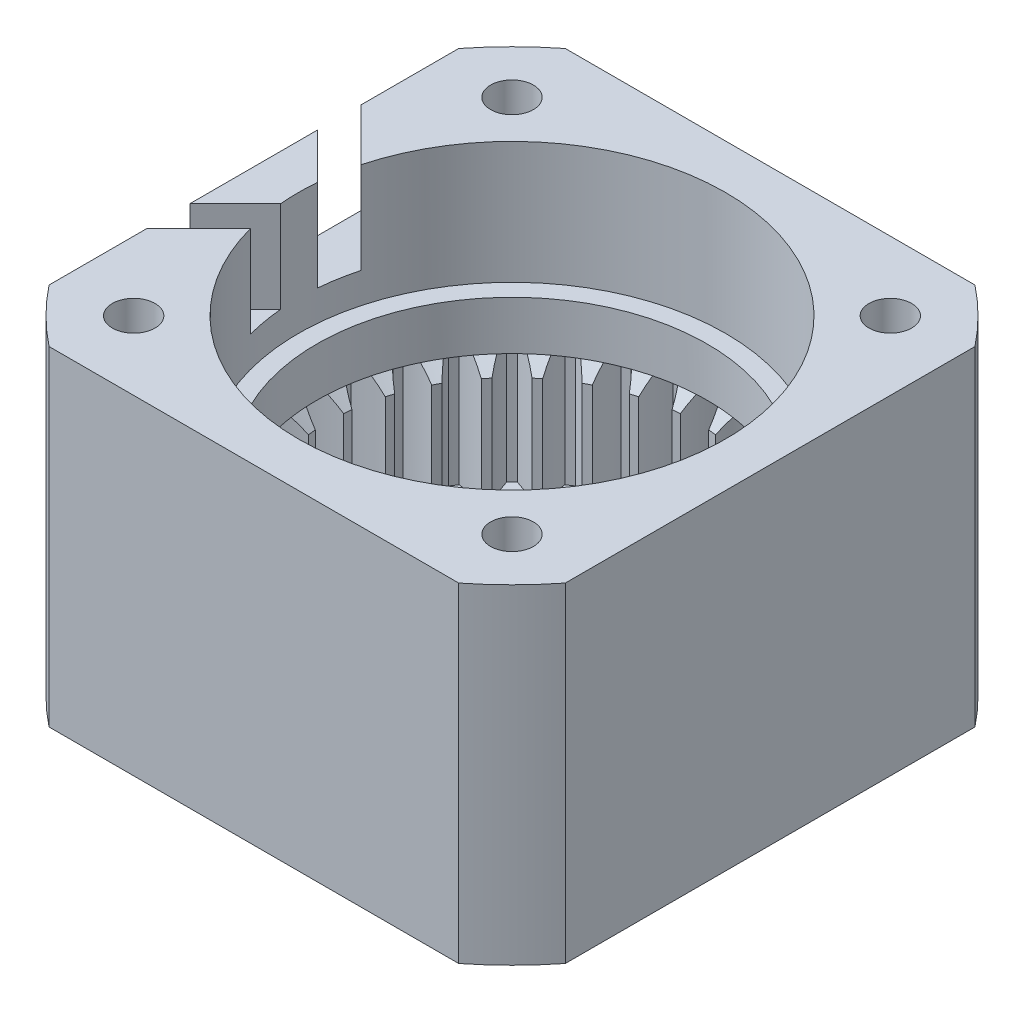
from build123d import *

# Parameters (mm, degrees)
SKETCH2_W           = 42.3
SKETCH2_H           = 42.3
BOSS_EXTRUDE1_DEPTH = 27
SKETCH3_R           = 11
CUT_EXTRUDE1_DEPTH  = 41.29447853
SKETCH4_R           = 1.75
CUT_EXTRUDE2_DEPTH  = 41.29447853
SKETCH5_R           = 29.910616844
SKETCH5_R_2         = 27
CUT_EXTRUDE4_DEPTH  = 41.29447853
CUT_EXTRUDE5_DEPTH  = 24
BOSS_EXTRUDE2_START = 14
SKETCH7_R           = 16
BOSS_EXTRUDE2_DEPTH = 14
BOSS_EXTRUDE4_START = 2.5
BOSS_EXTRUDE4_DEPTH = 2.5
SKETCH9_R           = 13
CUT_EXTRUDE6_DEPTH  = 39.348989556
INTERNAL_START      = 10
SKETCH12_R          = 16
SKETCH12_R_2        = 15
INTERNAL_GEAR_DEPTH = 10
CHAMFER4_SIZE       = 0.5
CAVITY2_START       = 3
CAVITY2_DEPTH       = 10


# Read off the part's stored shape, not the designer's step: Cavity2
with BuildPart() as part:
    # Sketch2 → Boss-Extrude1 (new body)
    with BuildSketch(Plane(origin=(0, 0, 0), x_dir=(1, 0, 0), z_dir=(0, 1, 0))):
        Rectangle(SKETCH2_W, SKETCH2_H)
    extrude(amount=BOSS_EXTRUDE1_DEPTH)

    # Sketch3 → Cut-Extrude1 (cut, through all)
    with BuildSketch(Plane(origin=(0, 27, 0), x_dir=(1, 0, 0), z_dir=(0, 1, 0))):
        with Locations(Location((0, 0, 0), (0, 0, 270))):
            Circle(SKETCH3_R)
    extrude(amount=-CUT_EXTRUDE1_DEPTH, mode=Mode.SUBTRACT)

    # Sketch4 → Cut-Extrude2 (cut, through all)
    with BuildSketch(Plane(origin=(0, 27, 0), x_dir=(1, 0, 0), z_dir=(0, 1, 0))):
        with Locations(Location((-15.5, 15.5, 0), (0, 0, 270))):
            Circle(SKETCH4_R)
        with Locations(Location((15.5, 15.5, 0), (0, 0, 270))):
            Circle(SKETCH4_R)
        with Locations(Location((15.5, -15.5, 0), (0, 0, 270))):
            Circle(SKETCH4_R)
        with Locations(Location((-15.5, -15.5, 0), (0, 0, 270))):
            Circle(SKETCH4_R)
    extrude(amount=-CUT_EXTRUDE2_DEPTH, mode=Mode.SUBTRACT)

    # Sketch5 → Cut-Extrude4 (cut, through all)
    with BuildSketch(Plane(origin=(0, 27, 0), x_dir=(1, 0, 0), z_dir=(0, 1, 0))):
        Circle(SKETCH5_R)
        Circle(SKETCH5_R_2, mode=Mode.SUBTRACT)
    extrude(amount=-CUT_EXTRUDE4_DEPTH, mode=Mode.SUBTRACT)

    # Sketch6 → Cut-Extrude5 (cut)
    with BuildSketch(Plane(origin=(0, 27, 0), x_dir=(1, 0, 0), z_dir=(0, 1, 0))):
        with BuildLine():
            Line((-21.15, 8.767766953), (-21.15, 5.232233047))
            Line((-21.15, 5.232233047), (-17.434176285, 1.516409332))
            ThreePointArc((-17.434176285, 1.516409332), (-17.5, 0), (-17.434176285, -1.516409332))
            Line((-17.434176285, -1.516409332), (-21.15, -5.232233047))
            Line((-21.15, -5.232233047), (-21.15, -8.767766953))
            Line((-21.15, -8.767766953), (-16.905362936, -4.523129889))
            ThreePointArc((-16.905362936, -4.523129889), (17.5, 0), (-16.905362936, 4.523129889))
            Line((-16.905362936, 4.523129889), (-21.15, 8.767766953))
        make_face()
    extrude(amount=-CUT_EXTRUDE5_DEPTH, mode=Mode.SUBTRACT)

    # Sketch7 → Boss-Extrude2 (add)
    with BuildSketch(Plane(origin=(0, 3, 0), x_dir=(1, 0, 0), z_dir=(0, 1, 0)).offset(BOSS_EXTRUDE2_START)):
        with BuildLine():
            Line((-17.434176285, -1.516409332), (-21.15, -5.232233047))
            Line((-21.15, -5.232233047), (-21.15, -8.767766953))
            Line((-21.15, -8.767766953), (-16.905362936, -4.523129889))
            ThreePointArc((-16.905362936, -4.523129889), (17.5, 0), (-16.905362936, 4.523129889))
            Line((-16.905362936, 4.523129889), (-21.15, 8.767766953))
            Line((-21.15, 8.767766953), (-21.15, 5.232233047))
            Line((-21.15, 5.232233047), (-17.434176285, 1.516409332))
            ThreePointArc((-17.434176285, 1.516409332), (-17.5, 0), (-17.434176285, -1.516409332))
        make_face()
        with Locations(Location((0, 0, 0), (0, 0, 270))):
            Circle(SKETCH7_R, mode=Mode.SUBTRACT)
    extrude(amount=-BOSS_EXTRUDE2_DEPTH)

    # Sketch10 → Boss-Extrude4 (add)
    with BuildSketch(Plane(origin=(0, 17, 0), x_dir=(1, 0, 0), z_dir=(0, 1, 0)).offset(BOSS_EXTRUDE4_START)):
        with BuildLine():
            Line((-16.905362936, 4.523129889), (-21.15, 8.767766953))
            Line((-21.15, 8.767766953), (-21.15, 5.232233047))
            Line((-21.15, 5.232233047), (-17.434176285, 1.516409332))
            ThreePointArc((-17.434176285, 1.516409332), (-17.235459977, 3.031323043), (-16.905362936, 4.523129889))
        make_face()
        with BuildLine():
            Line((-16.905362936, -4.523129889), (-21.15, -8.767766953))
            Line((-21.15, -8.767766953), (-21.15, -5.232233047))
            Line((-21.15, -5.232233047), (-17.434176285, -1.516409332))
            ThreePointArc((-17.434176285, -1.516409332), (-17.235459977, -3.031323043), (-16.905362936, -4.523129889))
        make_face()
    extrude(amount=-BOSS_EXTRUDE4_DEPTH)

    # Sketch9 → Cut-Extrude6 (cut, through all)
    with BuildSketch(Plane(origin=(0, 3, 0), x_dir=(1, 0, 0), z_dir=(0, 1, 0))):
        with Locations(Location((0, 0, 0), (0, 0, 270))):
            Circle(SKETCH9_R)
    extrude(amount=-CUT_EXTRUDE6_DEPTH, mode=Mode.SUBTRACT)

    # Sketch12 → Internal gear (add)
    with BuildSketch(Plane(origin=(0, 3, 0), x_dir=(1, 0, 0), z_dir=(0, 1, 0)).offset(INTERNAL_START)):
        with Locations(Location((0, 0, 0), (0, 0, 270))):
            Circle(SKETCH12_R)
        with Locations(Location((0, 0, 0), (0, 0, 270))):
            Circle(SKETCH12_R_2, mode=Mode.SUBTRACT)
    extrude(amount=-INTERNAL_GEAR_DEPTH)

    # Chamfer4
    chamfer4_edges = [part.edges().sort_by_distance(p)[0] for p in [
        (-15.5, 0, 13.75),
        (15.5, 0, 13.75),
        (15.5, 0, -17.25),
        (-15.5, 0, -17.25),
    ]]
    chamfer(chamfer4_edges, length=CHAMFER4_SIZE)

    # Cavity2 outline → Cavity2 (cut)
    with BuildSketch(Plane(origin=(0, 0, 0), x_dir=(1, 0, 0), z_dir=(0, 1, 0)).offset(CAVITY2_START)):
        with BuildLine():
            ThreePointArc((-3.668509067, -16.856424361), (-3.365503145, -16.919526872), (-3.06141389, -16.977183099))
            ThreePointArc((-3.06141389, -16.977183099), (-2.340339096, -15.984916584), (-1.779431222, -14.894080184))
            ThreePointArc((-1.779431222, -14.894080184), (-2.92635483, -14.711779206), (-4.055737641, -14.441294685))
            ThreePointArc((-4.055737641, -14.441294685), (-3.954971354, -15.663746259), (-3.668509067, -16.856424361))
        make_face()
        with BuildLine():
            ThreePointArc((1.160450949, -14.95504442), (0, -15), (-1.160450949, -14.95504442))
            ThreePointArc((-1.160450949, -14.95504442), (-0.823132387, -16.134348402), (-0.309494437, -17.248223508))
            ThreePointArc((-0.309494437, -17.248223508), (0, -17.251), (0.309494437, -17.248223508))
            ThreePointArc((0.309494437, -17.248223508), (0.823132387, -16.134348402), (1.160450949, -14.95504442))
        make_face()
        with BuildLine():
            ThreePointArc((-6.314673798, -16.053719065), (-5.413872661, -15.221193386), (-4.650930849, -14.260744799))
            ThreePointArc((-4.650930849, -14.260744799), (-5.740251485, -13.858192988), (-6.79516461, -13.372574095))
            ThreePointArc((-6.79516461, -13.372574095), (-6.93482299, -14.591195132), (-6.88654495, -15.816842278))
            ThreePointArc((-6.88654495, -15.816842278), (-6.601671891, -15.937845815), (-6.314673798, -16.053719065))
        make_face()
        with BuildLine():
            ThreePointArc((4.055737641, -14.441294685), (2.92635483, -14.711779206), (1.779431222, -14.894080184))
            ThreePointArc((1.779431222, -14.894080184), (2.340339096, -15.984916584), (3.06141389, -16.977183099))
            ThreePointArc((3.06141389, -16.977183099), (3.365503145, -16.919526872), (3.668509067, -16.856424361))
            ThreePointArc((3.668509067, -16.856424361), (3.954971354, -15.663746259), (4.055737641, -14.441294685))
        make_face()
        with BuildLine():
            ThreePointArc((-9.325264334, -14.51331961), (-8.279354135, -13.872528263), (-7.343697812, -13.07937699))
            ThreePointArc((-7.343697812, -13.07937699), (-8.333553495, -12.472044185), (-9.273457214, -11.789952981))
            ThreePointArc((-9.273457214, -11.789952981), (-9.648173268, -12.957912559), (-9.839934773, -14.169427817))
            ThreePointArc((-9.839934773, -14.169427817), (-9.58414209, -14.343682282), (-9.325264334, -14.51331961))
        make_face()
        with BuildLine():
            ThreePointArc((6.79516461, -13.372574095), (5.740251485, -13.858192988), (4.650930849, -14.260744799))
            ThreePointArc((4.650930849, -14.260744799), (5.413872661, -15.221193386), (6.314673798, -16.053719065))
            ThreePointArc((6.314673798, -16.053719065), (6.601671891, -15.937845815), (6.88654495, -15.816842278))
            ThreePointArc((6.88654495, -15.816842278), (6.93482299, -14.591195132), (6.79516461, -13.372574095))
        make_face()
        with BuildLine():
            ThreePointArc((-11.977490191, -12.415181421), (-10.826664673, -11.990749658), (-9.754250587, -11.395376057))
            ThreePointArc((-9.754250587, -11.395376057), (-10.606601718, -10.606601718), (-11.395376057, -9.754250587))
            ThreePointArc((-11.395376057, -9.754250587), (-11.990749658, -10.826664673), (-12.415181421, -11.977490191))
            ThreePointArc((-12.415181421, -11.977490191), (-12.198299082, -12.198299082), (-11.977490191, -12.415181421))
        make_face()
        with BuildLine():
            ThreePointArc((9.273457214, -11.789952981), (8.333553495, -12.472044185), (7.343697812, -13.07937699))
            ThreePointArc((7.343697812, -13.07937699), (8.279354135, -13.872528263), (9.325264334, -14.51331961))
            ThreePointArc((9.325264334, -14.51331961), (9.58414209, -14.343682282), (9.839934773, -14.169427817))
            ThreePointArc((9.839934773, -14.169427817), (9.648173268, -12.957912559), (9.273457214, -11.789952981))
        make_face()
        with BuildLine():
            ThreePointArc((-14.169427817, -9.839934773), (-12.957912559, -9.648173268), (-11.789952981, -9.273457214))
            ThreePointArc((-11.789952981, -9.273457214), (-12.472044185, -8.333553495), (-13.07937699, -7.343697812))
            ThreePointArc((-13.07937699, -7.343697812), (-13.872528263, -8.279354135), (-14.51331961, -9.325264334))
            ThreePointArc((-14.51331961, -9.325264334), (-14.343682282, -9.58414209), (-14.169427817, -9.839934773))
        make_face()
        with BuildLine():
            ThreePointArc((11.395376057, -9.754250587), (10.606601718, -10.606601718), (9.754250587, -11.395376057))
            ThreePointArc((9.754250587, -11.395376057), (10.826664673, -11.990749658), (11.977490191, -12.415181421))
            ThreePointArc((11.977490191, -12.415181421), (12.198299082, -12.198299082), (12.415181421, -11.977490191))
            ThreePointArc((12.415181421, -11.977490191), (11.990749658, -10.826664673), (11.395376057, -9.754250587))
        make_face()
        with BuildLine():
            ThreePointArc((-15.816842278, -6.88654495), (-14.591195132, -6.93482299), (-13.372574095, -6.79516461))
            ThreePointArc((-13.372574095, -6.79516461), (-13.858192988, -5.740251485), (-14.260744799, -4.650930849))
            ThreePointArc((-14.260744799, -4.650930849), (-15.221193386, -5.413872661), (-16.053719065, -6.314673798))
            ThreePointArc((-16.053719065, -6.314673798), (-15.937845815, -6.601671891), (-15.816842278, -6.88654495))
        make_face()
        with BuildLine():
            ThreePointArc((13.07937699, -7.343697812), (12.472044185, -8.333553495), (11.789952981, -9.273457214))
            ThreePointArc((11.789952981, -9.273457214), (12.957912559, -9.648173268), (14.169427817, -9.839934773))
            ThreePointArc((14.169427817, -9.839934773), (14.343682282, -9.58414209), (14.51331961, -9.325264334))
            ThreePointArc((14.51331961, -9.325264334), (13.872528263, -8.279354135), (13.07937699, -7.343697812))
        make_face()
        with BuildLine():
            ThreePointArc((-16.856424361, -3.668509067), (-15.663746259, -3.954971354), (-14.441294685, -4.055737641))
            ThreePointArc((-14.441294685, -4.055737641), (-14.711779206, -2.92635483), (-14.894080184, -1.779431222))
            ThreePointArc((-14.894080184, -1.779431222), (-15.984916584, -2.340339096), (-16.977183099, -3.06141389))
            ThreePointArc((-16.977183099, -3.06141389), (-16.919526872, -3.365503145), (-16.856424361, -3.668509067))
        make_face()
        with BuildLine():
            ThreePointArc((14.260744799, -4.650930849), (13.858192988, -5.740251485), (13.372574095, -6.79516461))
            ThreePointArc((13.372574095, -6.79516461), (14.591195132, -6.93482299), (15.816842278, -6.88654495))
            ThreePointArc((15.816842278, -6.88654495), (15.937845815, -6.601671891), (16.053719065, -6.314673798))
            ThreePointArc((16.053719065, -6.314673798), (15.221193386, -5.413872661), (14.260744799, -4.650930849))
        make_face()
        with BuildLine():
            ThreePointArc((-17.248223508, -0.309494437), (-16.134348402, -0.823132387), (-14.95504442, -1.160450949))
            ThreePointArc((-14.95504442, -1.160450949), (-15, 0), (-14.95504442, 1.160450949))
            ThreePointArc((-14.95504442, 1.160450949), (-16.134348402, 0.823132387), (-17.248223508, 0.309494437))
            ThreePointArc((-17.248223508, 0.309494437), (-17.251, 0), (-17.248223508, -0.309494437))
        make_face()
        with BuildLine():
            ThreePointArc((14.894080184, -1.779431222), (14.711779206, -2.92635483), (14.441294685, -4.055737641))
            ThreePointArc((14.441294685, -4.055737641), (15.663746259, -3.954971354), (16.856424361, -3.668509067))
            ThreePointArc((16.856424361, -3.668509067), (16.919526872, -3.365503145), (16.977183099, -3.06141389))
            ThreePointArc((16.977183099, -3.06141389), (15.984916584, -2.340339096), (14.894080184, -1.779431222))
        make_face()
        with BuildLine():
            ThreePointArc((-16.977183099, 3.06141389), (-15.984916584, 2.340339096), (-14.894080184, 1.779431222))
            ThreePointArc((-14.894080184, 1.779431222), (-14.711779206, 2.92635483), (-14.441294685, 4.055737641))
            ThreePointArc((-14.441294685, 4.055737641), (-15.663746259, 3.954971354), (-16.856424361, 3.668509067))
            ThreePointArc((-16.856424361, 3.668509067), (-16.919526872, 3.365503145), (-16.977183099, 3.06141389))
        make_face()
        with BuildLine():
            ThreePointArc((14.95504442, 1.160450949), (15, 0), (14.95504442, -1.160450949))
            ThreePointArc((14.95504442, -1.160450949), (16.134348402, -0.823132387), (17.248223508, -0.309494437))
            ThreePointArc((17.248223508, -0.309494437), (17.251, 0), (17.248223508, 0.309494437))
            ThreePointArc((17.248223508, 0.309494437), (16.134348402, 0.823132387), (14.95504442, 1.160450949))
        make_face()
        with BuildLine():
            ThreePointArc((-16.053719065, 6.314673798), (-15.221193386, 5.413872661), (-14.260744799, 4.650930849))
            ThreePointArc((-14.260744799, 4.650930849), (-13.858192988, 5.740251485), (-13.372574095, 6.79516461))
            ThreePointArc((-13.372574095, 6.79516461), (-14.591195132, 6.93482299), (-15.816842278, 6.88654495))
            ThreePointArc((-15.816842278, 6.88654495), (-15.937845815, 6.601671891), (-16.053719065, 6.314673798))
        make_face()
        with BuildLine():
            ThreePointArc((-14.51331961, 9.325264334), (-13.872528263, 8.279354135), (-13.07937699, 7.343697812))
            ThreePointArc((-13.07937699, 7.343697812), (-12.472044185, 8.333553495), (-11.789952981, 9.273457214))
            ThreePointArc((-11.789952981, 9.273457214), (-12.957912559, 9.648173268), (-14.169427817, 9.839934773))
            ThreePointArc((-14.169427817, 9.839934773), (-14.343682282, 9.58414209), (-14.51331961, 9.325264334))
        make_face()
        with BuildLine():
            ThreePointArc((14.441294685, 4.055737641), (14.711779206, 2.92635483), (14.894080184, 1.779431222))
            ThreePointArc((14.894080184, 1.779431222), (15.984916584, 2.340339096), (16.977183099, 3.06141389))
            ThreePointArc((16.977183099, 3.06141389), (16.919526872, 3.365503145), (16.856424361, 3.668509067))
            ThreePointArc((16.856424361, 3.668509067), (15.663746259, 3.954971354), (14.441294685, 4.055737641))
        make_face()
        with BuildLine():
            ThreePointArc((-12.415181421, 11.977490191), (-11.990749658, 10.826664673), (-11.395376057, 9.754250587))
            ThreePointArc((-11.395376057, 9.754250587), (-10.606601718, 10.606601718), (-9.754250587, 11.395376057))
            ThreePointArc((-9.754250587, 11.395376057), (-10.826664673, 11.990749658), (-11.977490191, 12.415181421))
            ThreePointArc((-11.977490191, 12.415181421), (-12.198299082, 12.198299082), (-12.415181421, 11.977490191))
        make_face()
        with BuildLine():
            ThreePointArc((13.372574095, 6.79516461), (13.858192988, 5.740251485), (14.260744799, 4.650930849))
            ThreePointArc((14.260744799, 4.650930849), (15.221193386, 5.413872661), (16.053719065, 6.314673798))
            ThreePointArc((16.053719065, 6.314673798), (15.937845815, 6.601671891), (15.816842278, 6.88654495))
            ThreePointArc((15.816842278, 6.88654495), (14.591195132, 6.93482299), (13.372574095, 6.79516461))
        make_face()
        with BuildLine():
            ThreePointArc((-9.839934773, 14.169427817), (-9.648173268, 12.957912559), (-9.273457214, 11.789952981))
            ThreePointArc((-9.273457214, 11.789952981), (-8.333553495, 12.472044185), (-7.343697812, 13.07937699))
            ThreePointArc((-7.343697812, 13.07937699), (-8.279354135, 13.872528263), (-9.325264334, 14.51331961))
            ThreePointArc((-9.325264334, 14.51331961), (-9.58414209, 14.343682282), (-9.839934773, 14.169427817))
        make_face()
        with BuildLine():
            ThreePointArc((11.789952981, 9.273457214), (12.472044185, 8.333553495), (13.07937699, 7.343697812))
            ThreePointArc((13.07937699, 7.343697812), (13.872528263, 8.279354135), (14.51331961, 9.325264334))
            ThreePointArc((14.51331961, 9.325264334), (14.343682282, 9.58414209), (14.169427817, 9.839934773))
            ThreePointArc((14.169427817, 9.839934773), (12.957912559, 9.648173268), (11.789952981, 9.273457214))
        make_face()
        with BuildLine():
            ThreePointArc((-6.88654495, 15.816842278), (-6.93482299, 14.591195132), (-6.79516461, 13.372574095))
            ThreePointArc((-6.79516461, 13.372574095), (-5.740251485, 13.858192988), (-4.650930849, 14.260744799))
            ThreePointArc((-4.650930849, 14.260744799), (-5.413872661, 15.221193386), (-6.314673798, 16.053719065))
            ThreePointArc((-6.314673798, 16.053719065), (-6.601671891, 15.937845815), (-6.88654495, 15.816842278))
        make_face()
        with BuildLine():
            ThreePointArc((9.754250587, 11.395376057), (10.606601718, 10.606601718), (11.395376057, 9.754250587))
            ThreePointArc((11.395376057, 9.754250587), (11.990749658, 10.826664673), (12.415181421, 11.977490191))
            ThreePointArc((12.415181421, 11.977490191), (12.198299082, 12.198299082), (11.977490191, 12.415181421))
            ThreePointArc((11.977490191, 12.415181421), (10.826664673, 11.990749658), (9.754250587, 11.395376057))
        make_face()
        with BuildLine():
            ThreePointArc((-3.668509067, 16.856424361), (-3.954971354, 15.663746259), (-4.055737641, 14.441294685))
            ThreePointArc((-4.055737641, 14.441294685), (-2.92635483, 14.711779206), (-1.779431222, 14.894080184))
            ThreePointArc((-1.779431222, 14.894080184), (-2.340339096, 15.984916584), (-3.06141389, 16.977183099))
            ThreePointArc((-3.06141389, 16.977183099), (-3.365503145, 16.919526872), (-3.668509067, 16.856424361))
        make_face()
        with BuildLine():
            ThreePointArc((7.343697812, 13.07937699), (8.333553495, 12.472044185), (9.273457214, 11.789952981))
            ThreePointArc((9.273457214, 11.789952981), (9.648173268, 12.957912559), (9.839934773, 14.169427817))
            ThreePointArc((9.839934773, 14.169427817), (9.58414209, 14.343682282), (9.325264334, 14.51331961))
            ThreePointArc((9.325264334, 14.51331961), (8.279354135, 13.872528263), (7.343697812, 13.07937699))
        make_face()
        with BuildLine():
            ThreePointArc((-0.309494437, 17.248223508), (-0.823132387, 16.134348402), (-1.160450949, 14.95504442))
            ThreePointArc((-1.160450949, 14.95504442), (0, 15), (1.160450949, 14.95504442))
            ThreePointArc((1.160450949, 14.95504442), (0.823132387, 16.134348402), (0.309494437, 17.248223508))
            ThreePointArc((0.309494437, 17.248223508), (0, 17.251), (-0.309494437, 17.248223508))
        make_face()
        with BuildLine():
            ThreePointArc((4.650930849, 14.260744799), (5.740251485, 13.858192988), (6.79516461, 13.372574095))
            ThreePointArc((6.79516461, 13.372574095), (6.93482299, 14.591195132), (6.88654495, 15.816842278))
            ThreePointArc((6.88654495, 15.816842278), (6.601671891, 15.937845815), (6.314673798, 16.053719065))
            ThreePointArc((6.314673798, 16.053719065), (5.413872661, 15.221193386), (4.650930849, 14.260744799))
        make_face()
        with BuildLine():
            ThreePointArc((3.06141389, 16.977183099), (2.340339096, 15.984916584), (1.779431222, 14.894080184))
            ThreePointArc((1.779431222, 14.894080184), (2.92635483, 14.711779206), (4.055737641, 14.441294685))
            ThreePointArc((4.055737641, 14.441294685), (3.954971354, 15.663746259), (3.668509067, 16.856424361))
            ThreePointArc((3.668509067, 16.856424361), (3.365503145, 16.919526872), (3.06141389, 16.977183099))
        make_face()
    extrude(amount=CAVITY2_DEPTH, mode=Mode.SUBTRACT)

    # Sketch13 → Cut-Revolve4 (revolve, cut)
    with BuildSketch(Plane(origin=(0, 0, 0), x_dir=(0, 0, -1), z_dir=(1, 0, 0))):
        Polygon((-16, 13), (-15, 12), (-15, 13), align=None)
    revolve(axis=Axis((0, 27, 0), (0, -1, 0)), mode=Mode.SUBTRACT)


solid = part.part
